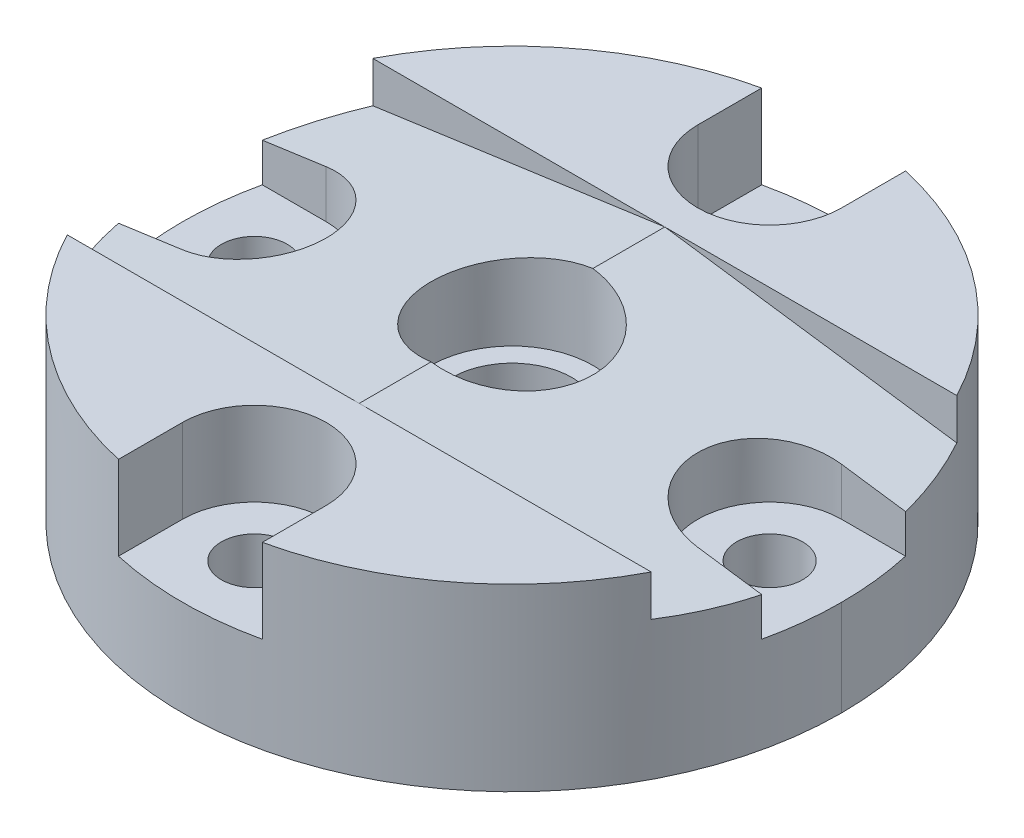
from build123d import *

# Parameters (mm, degrees)
SCHIZZO3_W                   = 110
SCHIZZO3_H                   = 30
ESTRUSIONE_ESTRUSIONE2_DEPTH = 55
RACCORDO1_R                  = 55
TAGLIO_ESTRUSIONE1_DEPTH     = 25.5
RACCORDO1_OF_SPECCHIA1_R     = 55
TAGLIO_ESTRUSIONE2_DEPTH     = 14
SCHIZZO9_R                   = 5.5
TAGLIO_ESTRUSIONE3_DEPTH     = 125.020159652
SCHIZZO10_R                  = 13.5
TAGLIO_ESTRUSIONE5_DEPTH     = 125.020159652
SCHIZZO11_R                  = 10
TAGLIO_ESTRUSIONE6_DEPTH     = 125.020159652


with BuildPart() as part:
    # Schizzo3 → Estrusione-Estrusione2 (new body)
    with BuildSketch(Plane.XY):
        with Locations((-55, 15)):
            Rectangle(SCHIZZO3_W, SCHIZZO3_H)
    estrusione_estrusione2 = extrude(amount=ESTRUSIONE_ESTRUSIONE2_DEPTH)

    # Raccordo1
    raccordo1_edges = [part.edges().sort_by_distance(p)[0] for p in [
        (-110, 15, 55),
        (0, 15, 55),
    ]]
    fillet(raccordo1_edges, radius=RACCORDO1_R - 0.0001)  # a hair under: the kernel refuses the full size

    # Schizzo6 → Taglio-Estrusione1 (cut)
    with BuildSketch(Plane(origin=(0, 0, 0), x_dir=(-1, 0, 0), z_dir=(0, 0, -1))):
        Polygon((0, 22.270254091), (55, 30), (0, 30), align=None)
        Polygon((110, 30), (55, 30), (110, 22.270254091), align=None)
    taglio_estrusione1 = extrude(amount=-TAGLIO_ESTRUSIONE1_DEPTH, mode=Mode.SUBTRACT)

    # Specchia1: Estrusione-Estrusione2, Taglio-Estrusione1 across plane
    add(estrusione_estrusione2.mirror(Plane.XY))
    add(taglio_estrusione1.mirror(Plane.XY), mode=Mode.SUBTRACT)

    # Raccordo1 of Specchia1
    raccordo1_of_specchia1_edges = [part.edges().sort_by_distance(p)[0] for p in [
        (-110, 15, -55),
        (0, 15, -55),
    ]]
    fillet(raccordo1_of_specchia1_edges, radius=RACCORDO1_OF_SPECCHIA1_R - 0.0001)  # a hair under: the kernel refuses the full size

    # Schizzo8 → Taglio-Estrusione2 (cut)
    with BuildSketch(Plane(origin=(0, 30, 0), x_dir=(1, 0, 0), z_dir=(0, 1, 0))):
        with BuildLine():
            Line((-43, -55), (-67, -55))
            Line((-67, -55), (-67, -43))
            ThreePointArc((-67, -43), (-55, -31), (-43, -43))
            Line((-43, -43), (-43, -55))
        make_face()
        with BuildLine():
            Line((-67, 55), (-67, 43))
            ThreePointArc((-67, 43), (-55, 31), (-43, 43))
            Line((-43, 43), (-43, 55))
            Line((-43, 55), (-67, 55))
        make_face()
        with BuildLine():
            Line((0, 12), (0, -12))
            Line((0, -12), (-12, -12))
            ThreePointArc((-12, -12), (-24, 0), (-12, 12))
            Line((-12, 12), (0, 12))
        make_face()
        with BuildLine():
            Line((-110, -12), (-98, -12))
            ThreePointArc((-98, -12), (-86, 0), (-98, 12))
            Line((-98, 12), (-110, 12))
            Line((-110, 12), (-110, -12))
        make_face()
    extrude(amount=-TAGLIO_ESTRUSIONE2_DEPTH, mode=Mode.SUBTRACT)

    # Schizzo9 → Taglio-Estrusione3 (cut, through all)
    with BuildSketch(Plane(origin=(0, 16, 0), x_dir=(1, 0, 0), z_dir=(0, 1, 0))):
        with Locations(Location((-12, 0, 0), (0, 0, 180))):
            Circle(SCHIZZO9_R)
        with Locations((-98, 0)):
            Circle(SCHIZZO9_R)
        with Locations(Location((-55, -43, 0), (0, 0, 180))):
            Circle(SCHIZZO9_R)
        with Locations((-55, 43)):
            Circle(SCHIZZO9_R)
    extrude(amount=-TAGLIO_ESTRUSIONE3_DEPTH, mode=Mode.SUBTRACT)

    # Schizzo10 → Taglio-Estrusione5 (cut, through all)
    with BuildSketch(Plane(origin=(0, 16, 0), x_dir=(1, 0, 0), z_dir=(0, 1, 0))):
        with Locations(Location((-55, 0, 0), (0, 0, 270))):
            Circle(SCHIZZO10_R)
    extrude(amount=TAGLIO_ESTRUSIONE5_DEPTH, mode=Mode.SUBTRACT)

    # Schizzo11 → Taglio-Estrusione6 (cut, through all)
    with BuildSketch(Plane(origin=(0, 16, 0), x_dir=(1, 0, 0), z_dir=(0, 1, 0))):
        with Locations(Location((-55, 0, 0), (0, 0, 180))):
            Circle(SCHIZZO11_R)
    extrude(amount=-TAGLIO_ESTRUSIONE6_DEPTH, mode=Mode.SUBTRACT)


solid = part.part
